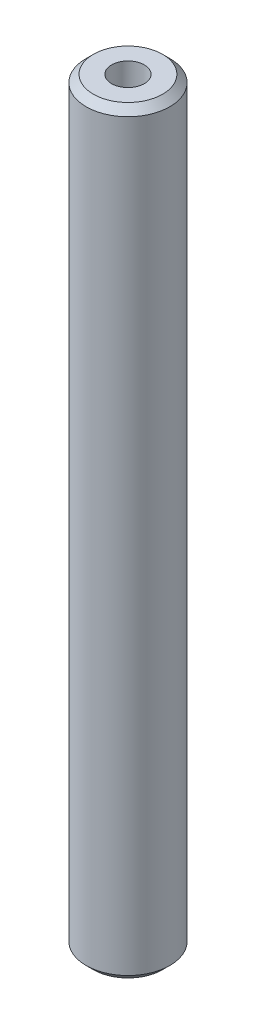
from build123d import *

# Parameters (mm, degrees)
SKETCH1_R           = 12.5
BOSS_EXTRUDE1_DEPTH = 226.520057947
SKETCH2_R           = 4.885394708
CUT_EXTRUDE1_DEPTH  = 228.208795279
CHAMFER1_SIZE       = 2.15863438


with BuildPart() as part:
    # Sketch1 → Boss-Extrude1 (new body)
    with BuildSketch(Plane(origin=(0, 0, 0), x_dir=(1, 0, 0), z_dir=(0, 1, 0))):
        Circle(SKETCH1_R)
    extrude(amount=BOSS_EXTRUDE1_DEPTH)

    # Sketch2 → Cut-Extrude1 (cut, through all)
    with BuildSketch(Plane(origin=(0, 0, 0), x_dir=(1, 0, 0), z_dir=(0, 1, 0))):
        Circle(SKETCH2_R)
    extrude(amount=CUT_EXTRUDE1_DEPTH, mode=Mode.SUBTRACT)

    # Chamfer1
    chamfer1_edges = [part.edges().sort_by_distance(p)[0] for p in [
        (-12.5, 226.520057947, 0),
        (-12.5, 0, 0),
    ]]
    chamfer(chamfer1_edges, length=CHAMFER1_SIZE)


solid = part.part
